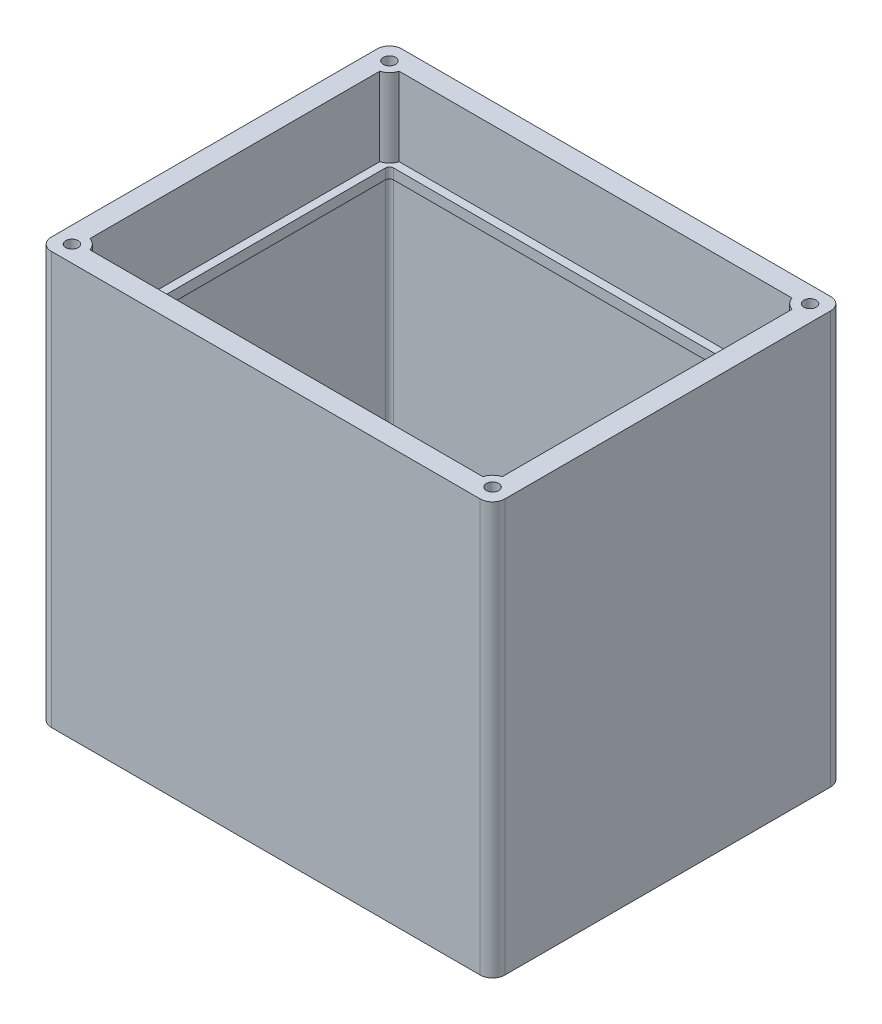
from build123d import *

# Parameters (mm, degrees)
SKETCH1_W                = 100
SKETCH1_H                = 75
BOSS_EXTRUDE1_DEPTH      = 95
SHELL1_T                 = 5
FILLET2_R                = 3
SKETCH6_R                = 3.5
BOSS_EXTRUDE4_DEPTH      = 19
SKETCH6_4_R              = 1.5
CUT_EXTRUDE2_DEPTH       = 15
FILLET3_R                = 1
BOSS_EXTRUDE5_DEPTH      = 1
BOSS_EXTRUDE5_DEPTH_BACK = 1.5
SKETCH8_W                = 100
SKETCH8_H                = 75
SKETCH8_W_2              = 96
SKETCH8_H_2              = 71
FILLET4_R                = 1


with BuildPart() as part:
    # Sketch1 → Boss-Extrude1 (new body)
    with BuildSketch(Plane(origin=(0, 0, 0), x_dir=(1, 0, 0), z_dir=(0, 1, 0))):
        with Locations((50, 37.5)):
            Rectangle(SKETCH1_W, SKETCH1_H)
    extrude(amount=BOSS_EXTRUDE1_DEPTH)

    # Shell1
    shell1_openings = [part.faces().sort_by_distance(p)[0] for p in [
        (50, 95, -37.5),
    ]]
    offset(amount=SHELL1_T, openings=shell1_openings, kind=Kind.INTERSECTION)

    # Fillet2
    # the kernel refuses this fillet: 3 mm, written as the material it takes off along each edge
    with BuildSketch(Plane(origin=(-5, -12.5, -80), x_dir=(1, 0, 0), z_dir=(0, 1, 0)), Plane(origin=(105, -12.5, -80), x_dir=(0, 0, 1), z_dir=(0, 1, 0)), Plane(origin=(105, -12.5, 5), x_dir=(-1, 0, 0), z_dir=(0, 1, 0)), Plane(origin=(-5, 102.5, 5), x_dir=(1, 0, 0), z_dir=(0, -1, 0))) as fillet2_piece_1:
        with BuildLine():
            CenterArc((FILLET2_R, -FILLET2_R), FILLET2_R, 90, 90)
            Line((0, -FILLET2_R), (0, 0))
            Line((0, 0), (FILLET2_R, 0))
        make_face()
    extrude(amount=115, mode=Mode.SUBTRACT)

    # Sketch6 → Boss-Extrude4 (add)
    with BuildSketch(Plane(origin=(0, 95, 0), x_dir=(1, 0, 0), z_dir=(0, 1, 0))):
        with Locations((-1, 76)):
            Circle(SKETCH6_R)
        with Locations((101, 76)):
            Circle(SKETCH6_R)
        with Locations((101, -1)):
            Circle(SKETCH6_R)
        with Locations((-1, -1)):
            Circle(SKETCH6_R)
    extrude(amount=-BOSS_EXTRUDE4_DEPTH)

    # Sketch6<4> → Cut-Extrude2 (cut)
    with BuildSketch(Plane(origin=(0, 95, 0), x_dir=(1, 0, 0), z_dir=(0, 1, 0))):
        with Locations(Location((-1, 76, 0), (0, 0, 270))):
            Circle(SKETCH6_4_R)
        with Locations(Location((101, 76, 0), (0, 0, 90))):
            Circle(SKETCH6_4_R)
        with Locations(Location((101, -1, 0), (0, 0, 270))):
            Circle(SKETCH6_4_R)
        with Locations(Location((-1, -1, 0), (0, 0, 90))):
            Circle(SKETCH6_4_R)
    extrude(amount=-CUT_EXTRUDE2_DEPTH, mode=Mode.SUBTRACT)

    # Fillet3
    fillet3_edges = [part.edges().sort_by_distance(p)[0] for p in [
        (0, 38, 0),
        (0, 38, -75),
        (100, 38, -75),
        (100, 38, 0),
    ]]
    fillet(fillet3_edges, radius=FILLET3_R)

    # Sketch8 → Boss-Extrude5 (add, two sides: drawn at the far end of the back side and taken through both)
    with BuildSketch(Plane(origin=(0, 75, 0), x_dir=(1, 0, 0), z_dir=(0, 1, 0)).offset(-BOSS_EXTRUDE5_DEPTH_BACK)):
        with Locations((50, 37.5)):
            Rectangle(SKETCH8_W, SKETCH8_H)
        with Locations((50, 37.5)):
            Rectangle(SKETCH8_W_2, SKETCH8_H_2, mode=Mode.SUBTRACT)
    extrude(amount=BOSS_EXTRUDE5_DEPTH + BOSS_EXTRUDE5_DEPTH_BACK)

    # Fillet4
    fillet4_edges = [part.edges().sort_by_distance(p)[0] for p in [
        (2, 74.75, -73),
        (98, 74.75, -73),
        (98, 74.75, -2),
        (2, 74.75, -2),
    ]]
    fillet(fillet4_edges, radius=FILLET4_R)


solid = part.part
